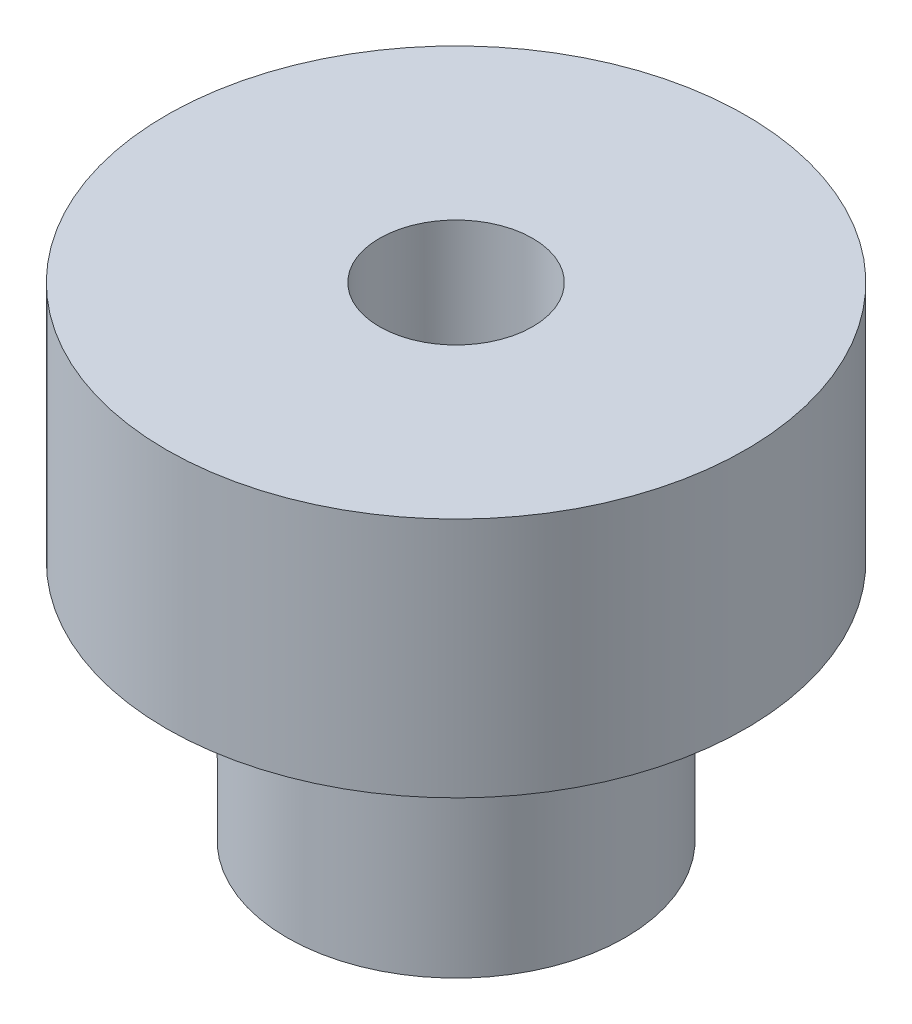
from build123d import *

# Parameters (mm, degrees)
SKETCH1_R           = 6
SKETCH1_R_2         = 1.586
BOSS_EXTRUDE1_DEPTH = 5
BOSS_EXTRUDE2_START = 5
SKETCH2_R           = 3.5
SKETCH2_R_2         = 1.586
BOSS_EXTRUDE2_DEPTH = 5
SKETCH3_R           = 1.25
CUT_EXTRUDE1_DEPTH  = 10


with BuildPart() as part:
    # Sketch1 → Boss-Extrude1 (new body)
    with BuildSketch(Plane(origin=(0, 0, 0), x_dir=(1, 0, 0), z_dir=(0, 1, 0))):
        Circle(SKETCH1_R)
        Circle(SKETCH1_R_2, mode=Mode.SUBTRACT)
    extrude(amount=BOSS_EXTRUDE1_DEPTH)

    # Sketch2 → Boss-Extrude2 (add)
    with BuildSketch(Plane.XZ.offset(BOSS_EXTRUDE2_START)):
        Circle(SKETCH2_R)
        Circle(SKETCH2_R_2, mode=Mode.SUBTRACT)
    extrude(amount=-BOSS_EXTRUDE2_DEPTH)

    # Sketch3 → Cut-Extrude1 (cut)
    with BuildSketch(Plane(origin=(0, 0, 0), x_dir=(0, 0, -1), z_dir=(1, 0, 0))):
        with Locations((0, -2.5)):
            Circle(SKETCH3_R)
    extrude(amount=-CUT_EXTRUDE1_DEPTH, mode=Mode.SUBTRACT)


solid = part.part
